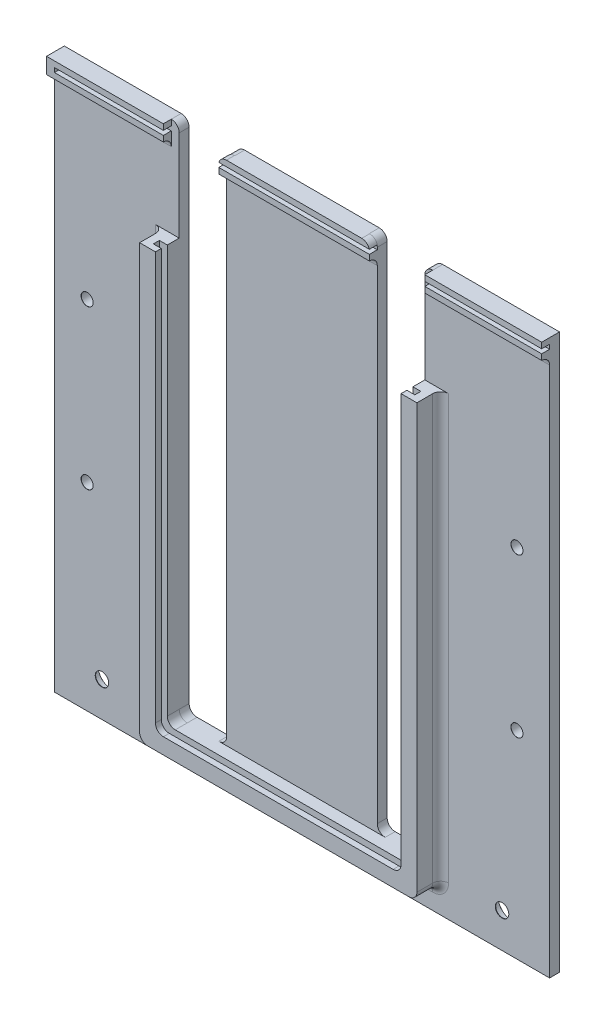
from build123d import *

# Parameters (mm, degrees)
ESBO_O1_W                                    = 125
ESBO_O1_H                                    = 140
RESSALTO_EXTRUS_O1_DEPTH                     = 2.5
RESSALTO_EXTRUS_O2_DEPTH                     = 6
ESBO_O3_W                                    = 1.52
ESBO_O3_H                                    = 105
CORTE_EXTRUS_O1_DEPTH                        = 2
ESBO_O4_W                                    = 1.52
ESBO_O4_H                                    = 105
CORTE_EXTRUS_O2_DEPTH                        = 2
ESBO_O5_W                                    = 66
ESBO_O5_H                                    = 1.52
CORTE_EXTRUS_O3_DEPTH                        = 2
FILETE1_R                                    = 2
FILETE2_R                                    = 2
FILETE3_R                                    = 2
ESBO_O6_W                                    = 12
ESBO_O6_H                                    = 130
CORTE_EXTRUS_O4_DEPTH                        = 138.929522592
FILETE4_R                                    = 2
FILETE5_R                                    = 2
ESBO_O7_W                                    = 19.009766083
ESBO_O7_H                                    = 4
ESBO_O7_W_2                                  = 19
ESBO_O7_W_3                                  = 29.5
RESSALTO_EXTRUS_O3_DEPTH                     = 2
ESBO_O8_W                                    = 123
ESBO_O8_H                                    = 1.1
CORTE_EXTRUS_O5_DEPTH                        = 2
FILETE6_R                                    = 2
FUROS_GUIA_COM_3_0MM1_D                      = 3
FUROS_GUIA_COM_3_0MM1_CSINK_D                = 3.05
FUROS_GUIA_COM_3_0MM1_CSINK_ANGLE            = 90
REBAIXO_PARA_PARAFUSO_COM_CABE_A_PAN_2_COUNT = 2
REBAIXO_PARA_PARAFUSO_COM_CABE_A_PAN_2_PITCH = 101


with BuildPart() as part:
    # Esboço1 → Ressalto-extrusão1 (new body)
    with BuildSketch(Plane.XY):
        with Locations((10.140586838, -47.097815293)):
            Rectangle(ESBO_O1_W, ESBO_O1_H)
    extrude(amount=RESSALTO_EXTRUS_O1_DEPTH)

    # Esboço2 → Ressalto-extrusão2 (add)
    with BuildSketch(Plane.XY.offset(2.5)):
        Polygon((-24.859413162, -2.097815293), (-20.859413162, -2.097815293), (-20.859413162, -107.097815293), (41.140586838, -107.097815293), (41.140586838, -2.097815293), (45.140586838, -2.097815293), (45.140586838, -107.097815293), (45.140586838, -111.097815293), (-24.859413162, -111.097815293), (-24.859413162, -107.097815293), align=None)
    extrude(amount=RESSALTO_EXTRUS_O2_DEPTH)

    # Esboço3 → Corte-extrusão1 (cut)
    with BuildSketch(Plane.ZY.offset(-41.140586838)):
        with Locations((6.26, -54.597815293)):
            Rectangle(ESBO_O3_W, ESBO_O3_H)
    extrude(amount=-CORTE_EXTRUS_O1_DEPTH, mode=Mode.SUBTRACT)

    # Esboço4 → Corte-extrusão2 (cut)
    with BuildSketch(Plane(origin=(-20.859413162, 0, 0), x_dir=(0, 0, -1), z_dir=(1, 0, 0))):
        with Locations((-6.26, -54.597815293)):
            Rectangle(ESBO_O4_W, ESBO_O4_H)
    extrude(amount=-CORTE_EXTRUS_O2_DEPTH, mode=Mode.SUBTRACT)

    # Esboço5 → Corte-extrusão3 (cut)
    with BuildSketch(Plane(origin=(0, -107.097815293, 0), x_dir=(1, 0, 0), z_dir=(0, 1, 0))):
        with Locations((10.140586838, -6.26)):
            Rectangle(ESBO_O5_W, ESBO_O5_H)
    extrude(amount=-CORTE_EXTRUS_O3_DEPTH, mode=Mode.SUBTRACT)

    # Filete1
    filete1_edges = [part.edges().sort_by_distance(p)[0] for p in [
        (41.140586838, -107.097815293, 7.76),
        (-20.859413162, -107.097815293, 7.76),
        (41.140586838, -107.097815293, 4),
        (-20.859413162, -107.097815293, 4),
    ]]
    fillet(filete1_edges, radius=FILETE1_R)

    # Filete2
    filete2_edges = [part.edges().sort_by_distance(p)[0] for p in [
        (-24.859413162, -111.097815293, 5.5),
        (45.140586838, -111.097815293, 5.5),
    ]]
    fillet(filete2_edges, radius=FILETE2_R)

    # Filete3
    filete3_edges = [part.edges().sort_by_distance(p)[0] for p in [
        (10.140586838, -111.097815293, 2.5),
        (-24.273626724, -110.512028855, 2.5),
        (44.5548004, -110.512028855, 2.5),
        (-24.859413162, -55.597815293, 2.5),
        (45.140586838, -55.597815293, 2.5),
    ]]
    fillet(filete3_edges, radius=FILETE3_R)

    # Esboço6 → Corte-extrusão4 (cut, through all)
    with BuildSketch(Plane.XY.offset(2.5)):
        with Locations((-14.859413162, -42.097815293)):
            Rectangle(ESBO_O6_W, ESBO_O6_H)
        with Locations((35.140586838, -42.097815293)):
            Rectangle(ESBO_O6_W, ESBO_O6_H)
    extrude(amount=-CORTE_EXTRUS_O4_DEPTH, mode=Mode.SUBTRACT)

    # Filete4
    filete4_edges = [part.edges().sort_by_distance(p)[0] for p in [
        (-20.859413162, 22.902184707, 1.25),
        (-8.859413162, 22.902184707, 1.25),
        (41.140586838, 22.902184707, 1.25),
        (29.140586838, 22.902184707, 1.25),
    ]]
    fillet(filete4_edges, radius=FILETE4_R)

    # Filete5
    filete5_edges = [part.edges().sort_by_distance(p)[0] for p in [
        (-20.859413162, -107.097815293, 1.25),
        (-8.859413162, -107.097815293, 1.25),
        (41.140586838, -107.097815293, 1.25),
        (29.140586838, -107.097815293, 1.25),
    ]]
    fillet(filete5_edges, radius=FILETE5_R)

    # Esboço7 → Ressalto-extrusão3 (add)
    with BuildSketch(Plane.XY.offset(2.5)):
        with Locations((0.635703797, 20.902184707)):
            Rectangle(ESBO_O7_W, ESBO_O7_H)
        with Locations((19.640586838, 20.902184707)):
            Rectangle(ESBO_O7_W_2, ESBO_O7_H)
        with Locations((-37.609413162, 20.902184707)):
            Rectangle(ESBO_O7_W_3, ESBO_O7_H)
        with Locations((57.890586838, 20.902184707)):
            Rectangle(ESBO_O7_W_3, ESBO_O7_H)
    extrude(amount=RESSALTO_EXTRUS_O3_DEPTH)

    # Esboço8 → Corte-extrusão5 (cut)
    with BuildSketch(Plane.XY.offset(4.5)):
        with Locations((11.140586838, 20.902184707)):
            Rectangle(ESBO_O8_W, ESBO_O8_H)
    extrude(amount=-CORTE_EXTRUS_O5_DEPTH, mode=Mode.SUBTRACT)

    # Filete6
    # the kernel refuses this fillet: 2 mm, written as the material it adds along each edge
    with BuildSketch(Plane(origin=(29.140586838, 18.902184707, 2.5), x_dir=(0, 0, 1), z_dir=(-1, 0, 0))) as filete6_piece_1:
        with BuildLine():
            CenterArc((FILETE6_R, -FILETE6_R), FILETE6_R, 90, 90)
            Line((0, -FILETE6_R), (0, 0))
            Line((0, 0), (FILETE6_R, 0))
        make_face()
    extrude(amount=38)
    with BuildSketch(Plane(origin=(-52.359413162, 18.902184707, 2.5), x_dir=(0, 0, 1), z_dir=(1, 0, 0)), Plane(origin=(43.140586838, 18.902184707, 2.5), x_dir=(0, 0, 1), z_dir=(1, 0, 0))) as filete6_piece_2:
        with BuildLine():
            CenterArc((FILETE6_R, FILETE6_R), FILETE6_R, 180, 90)
            Line((0, FILETE6_R), (0, 0))
            Line((0, 0), (FILETE6_R, 0))
        make_face()
    extrude(amount=29.5)
    # the kernel refuses this fillet: 2 mm, written as the material it takes off along each edge
    with BuildSketch(Plane(origin=(29.140586838, 22.902184707, -2.307221131), x_dir=(-1, 0, 0), z_dir=(0, 0, 1))) as filete6_2_piece_1:
        with BuildLine():
            CenterArc((1.922888452, 2), FILETE6_R, 195.962014163, 74.037985837)
            Line((0, 1.45), (0, 0))
            Line((0, 0), (1.922888452, 0))
        make_face()
    extrude(amount=11.614442262, mode=Mode.SUBTRACT)
    with BuildSketch(Plane(origin=(-8.869179245, 22.902184707, -2.307221131), x_dir=(1, 0, 0), z_dir=(0, 0, 1))) as filete6_2_piece_2:
        with BuildLine():
            CenterArc((1.922888452, -2), FILETE6_R, 90, 74.037985837)
            Line((0, -1.45), (0, 0))
            Line((0, 0), (1.922888452, 0))
        make_face()
    extrude(amount=11.614442262, mode=Mode.SUBTRACT)

    # Furos-guia com Ø3.0mm1 (through all)
    with Locations(Plane.XY.offset(2.5)):
        with Locations((-44.109413162, -27.097815293), (-44.109413162, -67.097815293), (64.390586838, -27.094030717), (64.390586838, -67.094030814)):
            CounterSinkHole(FUROS_GUIA_COM_3_0MM1_D / 2, FUROS_GUIA_COM_3_0MM1_CSINK_D / 2, counter_sink_angle=FUROS_GUIA_COM_3_0MM1_CSINK_ANGLE)

    # Esboço14 → Rebaixo para parafuso com cabeça panela de M31 (revolve, cut)
    with BuildSketch(Plane(origin=(-40.359413162, -108.297815293, 0), x_dir=(0, 1, 0), z_dir=(1, 0, 0))):
        Polygon((0, 0), (0, 8.5), (1.7, 8.5), (1.7, 2.4), (3.5, 2.4), (3.5, 0.025), (3.525, 0), align=None)
    rebaixo_para_parafuso_com_cabe_a_panela = revolve(axis=Axis((-40.359413162, -108.297815293, -6.35), (0, 0, 1)), mode=Mode.SUBTRACT)

    # Rebaixo para parafuso com cabe_a pan 2: Rebaixo para parafuso com cabeça panela de M31 ×2
    with Locations(*[(i * REBAIXO_PARA_PARAFUSO_COM_CABE_A_PAN_2_PITCH, 0, 0) for i in range(1, REBAIXO_PARA_PARAFUSO_COM_CABE_A_PAN_2_COUNT)]):
        add(rebaixo_para_parafuso_com_cabe_a_panela, mode=Mode.SUBTRACT)


solid = part.part
